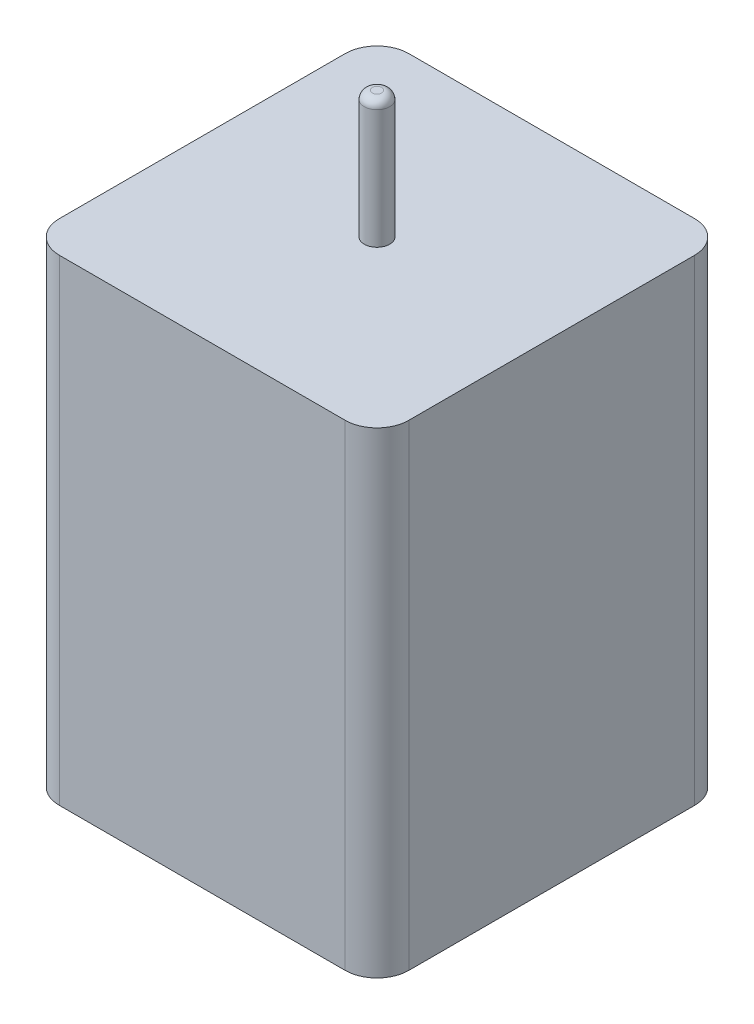
from build123d import *

# Parameters (mm, degrees)
SKETCH1_W           = 220
SKETCH1_H           = 220
BOSS_EXTRUDE1_DEPTH = 300
SKETCH2_R           = 8
BOSS_EXTRUDE2_DEPTH = 80
FILLET1_R           = 20
FILLET2_R           = 5


with BuildPart() as part:
    # Sketch1 → Boss-Extrude1 (new body)
    with BuildSketch(Plane(origin=(0, 0, 0), x_dir=(1, 0, 0), z_dir=(0, 1, 0))):
        Rectangle(SKETCH1_W, SKETCH1_H)
    extrude(amount=BOSS_EXTRUDE1_DEPTH)

    # Sketch2 → Boss-Extrude2 (add)
    with BuildSketch(Plane(origin=(0, 300, 0), x_dir=(1, 0, 0), z_dir=(0, 1, 0))):
        Circle(SKETCH2_R)
    extrude(amount=BOSS_EXTRUDE2_DEPTH)

    # Fillet1
    fillet1_edges = [part.edges().sort_by_distance(p)[0] for p in [
        (-110, 150, -110),
        (110, 150, -110),
        (110, 150, 110),
        (-110, 150, 110),
    ]]
    fillet(fillet1_edges, radius=FILLET1_R)

    # Fillet2
    fillet2_edges = [part.edges().sort_by_distance(p)[0] for p in [
        (-8, 380, 0),
    ]]
    fillet(fillet2_edges, radius=FILLET2_R)


solid = part.part
